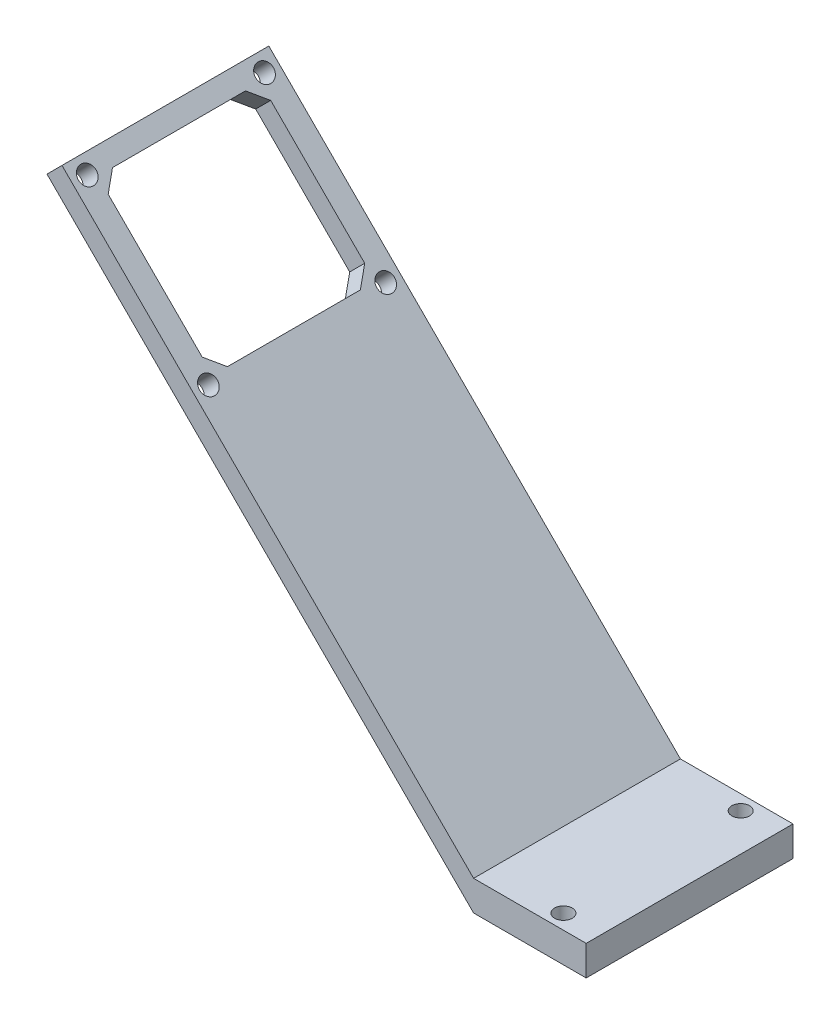
from build123d import *

# Parameters (mm, degrees)
BOSS_EXTRUDE1_DEPTH   = 35
CUT_EXTRUDE1_DEPTH    = 107.2427583
F_3_0MM_DOWEL_HOLE1_D = 3
F_3_0MM_DOWEL_HOLE2_D = 3


with BuildPart() as part:
    # Sketch2 → Boss-Extrude1 (new body)
    with BuildSketch(Plane.XY):
        Polygon((0, 0), (-69.650017947, 69.650017947), (-72.190017947, 67.110017947), (0, -5.08), (19.05, -5.08), (19.05, 0), align=None)
    extrude(amount=BOSS_EXTRUDE1_DEPTH)

    # Sketch3 → Cut-Extrude1 (cut, through all)
    with BuildSketch(Plane(origin=(0, 0, 0), x_dir=(0.7071067811865518, -0.7071067811865432, 0), z_dir=(0.7071067811865432, 0.7071067811865518, 0))):
        Polygon((-92.75, -3.75), (-95.25, -6.25), (-95.25, -28.75), (-92.75, -31.25), (-70.25, -31.25), (-67.75, -28.75), (-67.75, -6.25), (-70.25, -3.75), align=None)
    extrude(amount=-CUT_EXTRUDE1_DEPTH, mode=Mode.SUBTRACT)

    # Ø3.0mm Dowel Hole1 (through all)
    with Locations(Plane(origin=(-67.882250994, 67.882250994, 2.5), x_dir=(0.707106781187, -0.707106781187, 0), z_dir=(0.707106781187, 0.707106781187, 0))):
        with Locations((0, 0), (29, 0), (29, -30), (0, -30)):
            Hole(F_3_0MM_DOWEL_HOLE1_D / 2)

    # Ø3.0mm Dowel Hole2 (through all)
    with Locations(Plane(origin=(12.7, 0, 2.5), x_dir=(1, 0, 0), z_dir=(0, 1, 0))):
        with Locations((0, 0), (0, -30)):
            Hole(F_3_0MM_DOWEL_HOLE2_D / 2)


solid = part.part
